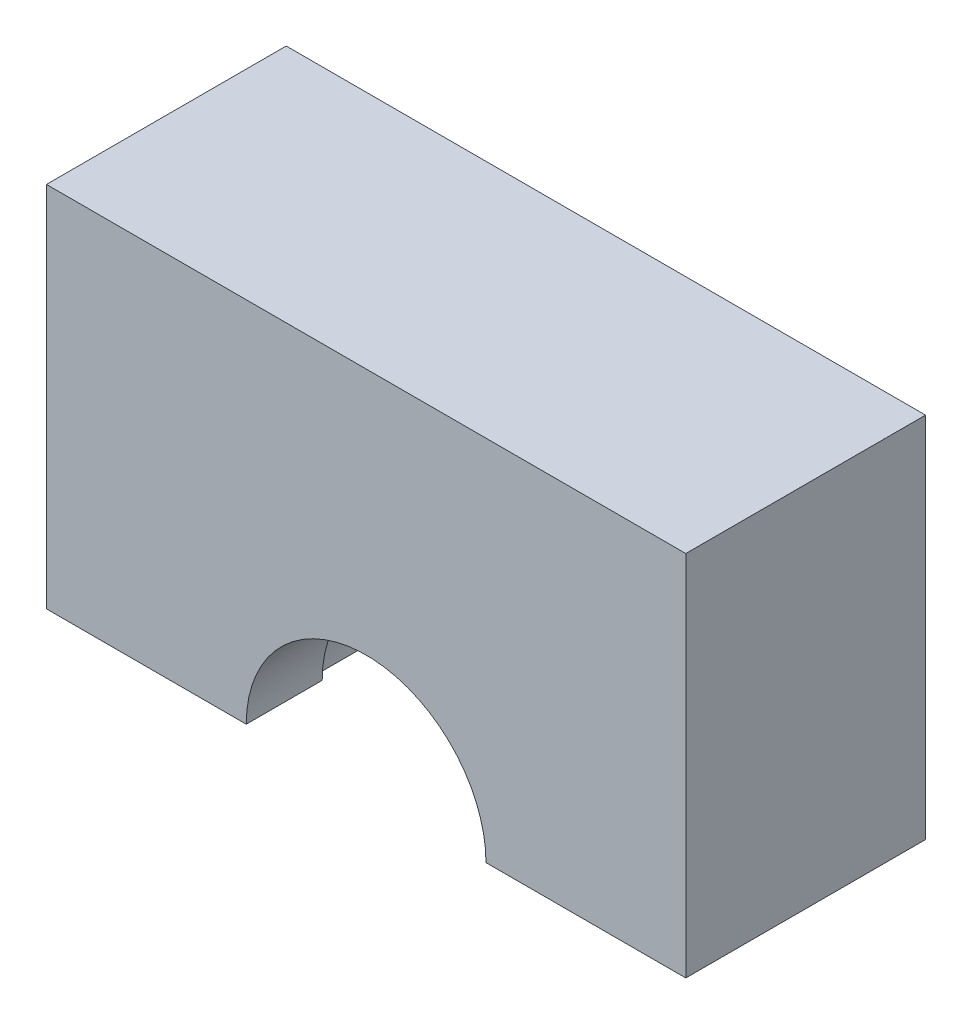
from build123d import *

# Parameters (mm, degrees)
BOSS_EXTRUDE1_DEPTH = 15
SKETCH2_W           = 5.5
SKETCH2_H           = 1.517546376


with BuildPart() as part:
    # Sketch1 → Boss-Extrude1 (new body)
    with BuildSketch(Plane.XY):
        with BuildLine():
            Line((-20, 23), (-20, 0))
            Line((-20, 0), (-7.5, 0))
            ThreePointArc((-7.5, 0), (0, 7.5), (7.5, 0))
            Line((7.5, 0), (20, 0))
            Line((20, 0), (20, 23))
            Line((20, 23), (-20, 23))
        make_face()
    extrude(amount=BOSS_EXTRUDE1_DEPTH)

    # Sketch2 → Cut-Revolve2 (revolve, cut)
    with BuildSketch(Plane(origin=(0, 0, 0), x_dir=(0, 0, -1), z_dir=(1, 0, 0))):
        with Locations((-7.5, 7.241226812)):
            Rectangle(SKETCH2_W, SKETCH2_H)
    revolve(axis=Axis((0, 0, 0), (0, 0, 1)), mode=Mode.SUBTRACT)


solid = part.part
